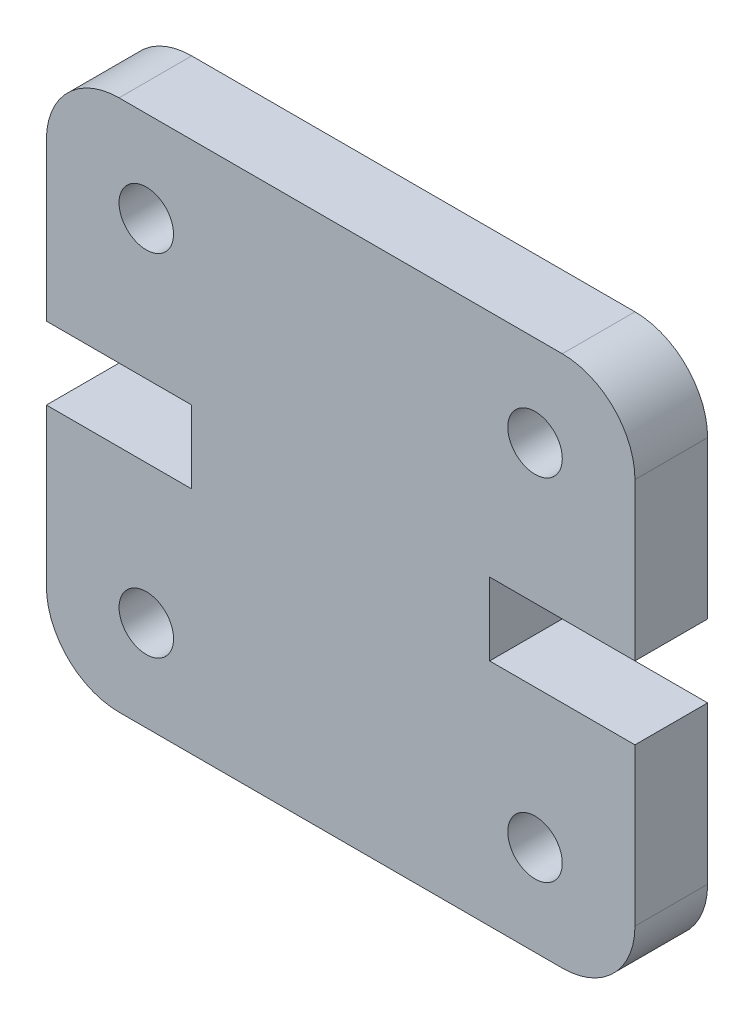
from build123d import *

# Parameters (mm, degrees)
SKETCH1_R           = 0.75
BOSS_EXTRUDE1_DEPTH = 4
SKETCH2_W           = 16.2
SKETCH2_H           = 14.645
CUT_EXTRUDE1_DEPTH  = 2


with BuildPart() as part:
    # Sketch1 → Boss-Extrude1 (new body)
    with BuildSketch(Plane.XY):
        with BuildLine():
            Line((2, 14.645), (14.2, 14.645))
            ThreePointArc((14.2, 14.645), (15.614213562, 14.059213562), (16.2, 12.645))
            Line((16.2, 12.645), (16.2, 8.3225))
            Line((16.2, 8.3225), (12.2, 8.3225))
            Line((12.2, 8.3225), (12.2, 6.3225))
            Line((12.2, 6.3225), (16.2, 6.3225))
            Line((16.2, 6.3225), (16.2, 2))
            ThreePointArc((16.2, 2), (15.614213562, 0.585786438), (14.2, 0))
            Line((14.2, 0), (2, 0))
            ThreePointArc((2, 0), (0.585786438, 0.585786438), (0, 2))
            Line((0, 2), (0, 6.3225))
            Line((0, 6.3225), (4, 6.3225))
            Line((4, 6.3225), (4, 8.3225))
            Line((4, 8.3225), (0, 8.3225))
            Line((0, 8.3225), (0, 12.645))
            ThreePointArc((0, 12.645), (0.585786438, 14.059213562), (2, 14.645))
        make_face()
        with Locations((2.75, 12.145)):
            Circle(SKETCH1_R, mode=Mode.SUBTRACT)
        with Locations((13.45, 2.5)):
            Circle(SKETCH1_R, mode=Mode.SUBTRACT)
        with Locations((13.45, 12.145)):
            Circle(SKETCH1_R, mode=Mode.SUBTRACT)
        with Locations((2.75, 2.5)):
            Circle(SKETCH1_R, mode=Mode.SUBTRACT)
    extrude(amount=BOSS_EXTRUDE1_DEPTH)

    # Sketch2 → Cut-Extrude1 (cut)
    with BuildSketch(Plane(origin=(0, 0, 0), x_dir=(-1, 0, 0), z_dir=(0, 0, -1))):
        with Locations((-8.1, 7.3225)):
            Rectangle(SKETCH2_W, SKETCH2_H)
    extrude(amount=-CUT_EXTRUDE1_DEPTH, mode=Mode.SUBTRACT)


solid = part.part
